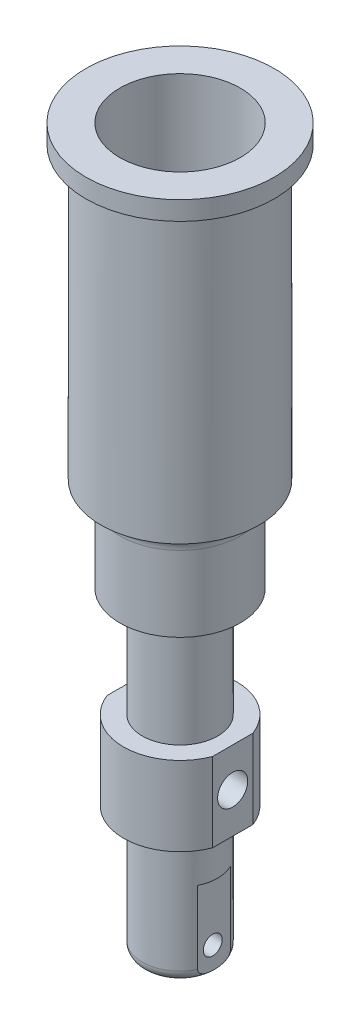
from build123d import *

# Parameters (mm, degrees)
SKETCH_1_R          = 21
SKETCH_1_R_2        = 16
EXTRUDE_1_DEPTH     = 70
EXTRUDE_START       = 7
SKETCH_3_R          = 21
EXTRUDE_2_DEPTH     = 7
SKETCH_4_R          = 10
EXTRUDE_3_DEPTH     = 109
FILLET_4_R          = 3
SKETCH_5_W          = 7.833460296
SKETCH_5_H          = 29.006841396
CUT_EXTRUDE_1_DEPTH = 38
SKETCH_9_R          = 2.5
CUT_EXTRUDE_3_DEPTH = 77.5
EXTRUDE_START_2     = 25
SKETCH_10_R         = 16
EXTRUDE_4_DEPTH     = 25
FILLET_5_R          = 5
SKETCH_11_R         = 25
SKETCH_11_R_2       = 16
EXTRUDE_5_DEPTH     = 5
SKETCH_14_R         = 15
EXTRUDE_6_DEPTH     = 21
SKETCH_7_R          = 4.000000002
CUT_EXTRUDE_2_DEPTH = 77.5
SKETCH_15_W         = 9.449953832
SKETCH_15_H         = 32.068314676
CUT_EXTRUDE_4_DEPTH = 25.5


with BuildPart() as part:
    # Эскиз1 → Вытянуть1 (new body)
    with BuildSketch(Plane(origin=(0, 0, 0), x_dir=(1, 0, 0), z_dir=(0, 1, 0))):
        with Locations(Location((0, 0, 0), (0, 0, 270))):
            Circle(SKETCH_1_R)
        with Locations(Location((0, 0, 0), (0, 0, 270))):
            Circle(SKETCH_1_R_2, mode=Mode.SUBTRACT)
    extrude(amount=EXTRUDE_1_DEPTH)

    # Эскиз3 → Вытянуть2 (add)
    with BuildSketch(Plane.XZ.offset(EXTRUDE_START)):
        with Locations(Location((0, 0, 0), (0, 0, 270))):
            Circle(SKETCH_3_R)
    extrude(amount=-EXTRUDE_2_DEPTH)

    # Эскиз4 → Вытянуть3 (add)
    with BuildSketch(Plane.XZ.offset(7)):
        with Locations(Location((0, 0, 0), (0, 0, 270))):
            Circle(SKETCH_4_R)
    extrude(amount=EXTRUDE_3_DEPTH)

    # Скругление4
    fillet_4_edges = [part.edges().sort_by_distance(p)[0] for p in [
        (0, -116, 10),
    ]]
    fillet(fillet_4_edges, radius=FILLET_4_R)

    # Эскиз5 → Вырез-Вытянуть1 (cut, symmetric)
    with BuildSketch(Plane.XY):
        with Locations((-12.931100354, -108.165099948)):
            Rectangle(SKETCH_5_W, SKETCH_5_H)
        with Locations((12.931100354, -108.165099948)):
            Rectangle(SKETCH_5_W, SKETCH_5_H)
    extrude(amount=CUT_EXTRUDE_1_DEPTH, both=True, mode=Mode.SUBTRACT)

    # Эскиз9 → Вырез-Вытянуть3 (cut, symmetric)
    with BuildSketch(Plane(origin=(-27.016636389, 0, -1.023584716), x_dir=(-0.03786003720910068, 0, 0.9992830517838905), z_dir=(-0.9992830517838904, 0, -0.03786003720910067))):
        with Locations(Location((-3.61e-07, -109.358787083, 0), (0, 0, 180))):
            Circle(SKETCH_9_R)
    extrude(amount=CUT_EXTRUDE_3_DEPTH, both=True, mode=Mode.SUBTRACT)

    # Эскиз10 → Вытянуть4 (add)
    with BuildSketch(Plane.XZ.offset(7).offset(EXTRUDE_START_2)):
        with Locations(Location((0, 0, 0), (0, 0, 90))):
            Circle(SKETCH_10_R)
    extrude(amount=-EXTRUDE_4_DEPTH)

    # Скругление5
    fillet_5_edges = [part.edges().sort_by_distance(p)[0] for p in [
        (0, -7, -16),
    ]]
    fillet(fillet_5_edges, radius=FILLET_5_R - 0.0001)  # a hair under: the kernel refuses the full size

    # Эскиз11 → Вытянуть5 (add)
    with BuildSketch(Plane(origin=(0, 70, 0), x_dir=(1, 0, 0), z_dir=(0, 1, 0))):
        with Locations(Location((0, 0, 0), (0, 0, 270))):
            Circle(SKETCH_11_R)
        with Locations(Location((0, 0, 0), (0, 0, 90))):
            Circle(SKETCH_11_R_2, mode=Mode.SUBTRACT)
    extrude(amount=EXTRUDE_5_DEPTH)

    # Эскиз14 → Вытянуть6 (add)
    with BuildSketch(Plane.XZ.offset(61)):
        with Locations(Location((0, 0, 0), (0, 0, 90))):
            Circle(SKETCH_14_R)
    extrude(amount=EXTRUDE_6_DEPTH)

    # Эскиз7 → Вырез-Вытянуть2 (cut, symmetric)
    with BuildSketch(Plane(origin=(-26.476014958, 0, -1.003102084), x_dir=(-0.037860037209100694, 0, 0.9992830517838905), z_dir=(-0.9992830517838904, 0, -0.03786003720910069))):
        with Locations((-0.488081216, -71.29866531)):
            Circle(SKETCH_7_R)
    extrude(amount=CUT_EXTRUDE_2_DEPTH, both=True, mode=Mode.SUBTRACT)

    # Эскиз15 → Вырез-Вытянуть4 (cut, symmetric)
    with BuildSketch(Plane.XY):
        with Locations((-18.736164954, -71.146680529)):
            Rectangle(SKETCH_15_W, SKETCH_15_H)
        with Locations((18.736164954, -71.146680529)):
            Rectangle(SKETCH_15_W, SKETCH_15_H)
    extrude(amount=CUT_EXTRUDE_4_DEPTH, both=True, mode=Mode.SUBTRACT)


solid = part.part
